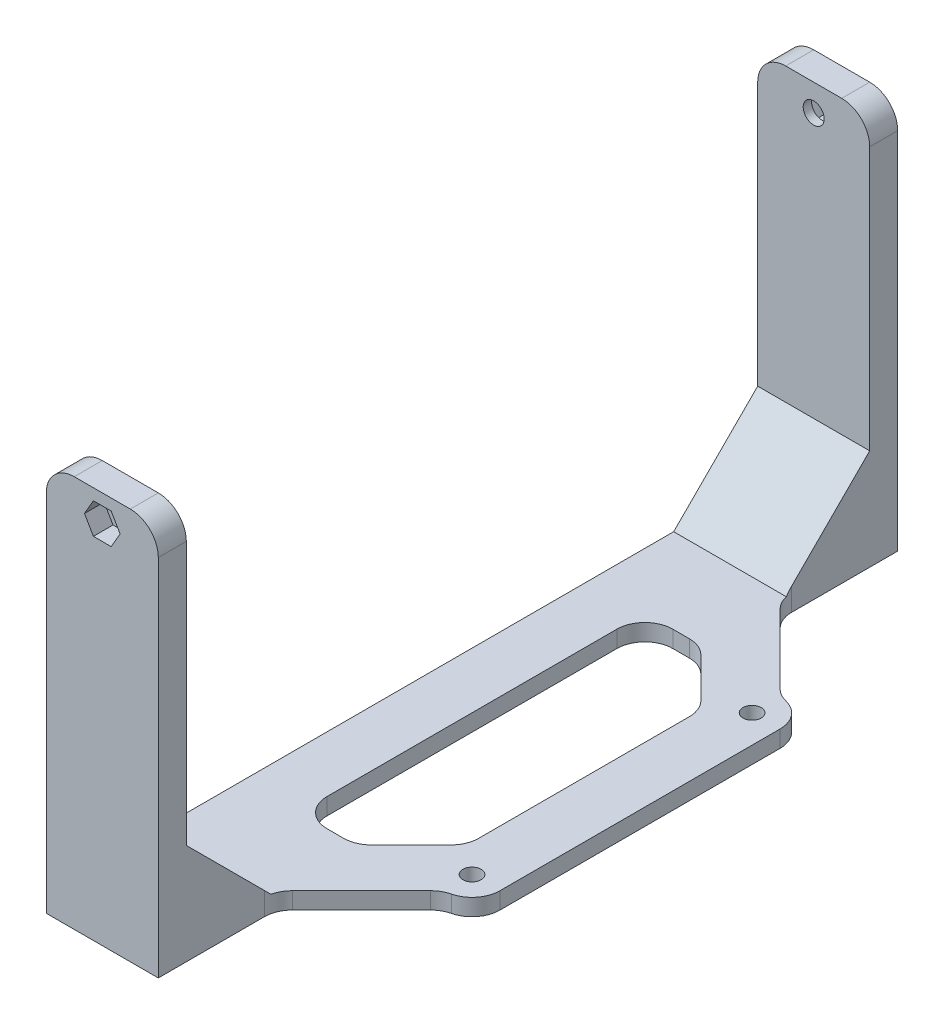
from build123d import *

# Parameters (mm, degrees)
SKETCH1_W           = 20
SKETCH1_H           = 132
BOSS_EXTRUDE1_DEPTH = 3
SKETCH2_W           = 20
SKETCH2_H           = 4.999999999999993
BOSS_EXTRUDE2_DEPTH = 67
SKETCH4_R           = 1.875000000000003
CUT_EXTRUDE1_DEPTH  = 150.74645237867907
FILLET3_R           = 5
CUT_EXTRUDE2_DEPTH  = 3.5
CUT_EXTRUDE3_DEPTH  = 3.5
SKETCH9_R           = 1.625000000000004
BOSS_EXTRUDE3_DEPTH = 3
CHAMFER1_SIZE       = 15
FILLET4_R           = 5
CUT_EXTRUDE4_DEPTH  = 99.71676655968832
FILLET5_R           = 5


with BuildPart() as part:
    # Sketch1 → Boss-Extrude1 (new body)
    with BuildSketch(Plane(origin=(0, 0, 0), x_dir=(1, 0, 0), z_dir=(0, 1, 0))):
        Rectangle(SKETCH1_W, SKETCH1_H)
    extrude(amount=BOSS_EXTRUDE1_DEPTH)

    # Sketch2 → Boss-Extrude2 (add)
    with BuildSketch(Plane(origin=(0, 3, 0), x_dir=(1, 0, 0), z_dir=(0, 1, 0))):
        Polygon((-10, -66), (10, -66), (9.999999999999998, -61.00000000000001), (-10, -61.00000000000001), align=None)
        with Locations((0, 63.5)):
            Rectangle(SKETCH2_W, SKETCH2_H)
    extrude(amount=BOSS_EXTRUDE2_DEPTH)

    # Sketch4 → Cut-Extrude1 (cut, through all)
    with BuildSketch(Plane.XY.offset(66)):
        with Locations((0, 65.2375)):
            Circle(SKETCH4_R)
    extrude(amount=-CUT_EXTRUDE1_DEPTH, mode=Mode.SUBTRACT)

    # Fillet3
    fillet3_edges = [part.edges().sort_by_distance(p)[0] for p in [
        (-10, 70, 63.5),
        (10, 70, 63.5),
        (-10, 70, -63.5),
        (10, 70, -63.5),
    ]]
    fillet(fillet3_edges, radius=FILLET3_R)

    # Sketch6 → Cut-Extrude2 (cut)
    with BuildSketch(Plane.XY.offset(66)):
        Polygon((3.175426480542929, 65.2375), (1.5877132402714664, 67.9875), (-1.5877132402714669, 67.9875), (-3.1754264805429386, 65.23749999999998), (-1.5877132402714738, 62.487500000000004), (1.587713240271455, 62.487500000000004), align=None)
    extrude(amount=-CUT_EXTRUDE2_DEPTH, mode=Mode.SUBTRACT)

    # Sketch7 → Cut-Extrude3 (cut)
    with BuildSketch(Plane(origin=(0, 0, -66), x_dir=(-1, 0, 0), z_dir=(0, 0, -1))):
        Polygon((3.2042939940024326, 65.2375), (1.6021469970012208, 68.0125), (-1.6021469970012086, 68.0125), (-3.204293994002428, 65.23749999999998), (-1.6021469970012214, 62.4625), (1.602146997001218, 62.4625), align=None)
    extrude(amount=-CUT_EXTRUDE3_DEPTH, mode=Mode.SUBTRACT)

    # Sketch9 → Boss-Extrude3 (add)
    with BuildSketch(Plane.XZ):
        Polygon((30.000000000000007, -29.999999999999996), (10, -30), (10, 30.000000000000004), (30.000000000000007, 30.000000000000004), align=None)
        with Locations(Location((25, -25, 0), (0, 0, 270))):
            Circle(SKETCH9_R, mode=Mode.SUBTRACT)
        with Locations(Location((25, 25, 0), (0, 0, 270))):
            Circle(SKETCH9_R, mode=Mode.SUBTRACT)
    extrude(amount=-BOSS_EXTRUDE3_DEPTH)

    # Chamfer1
    chamfer1_edges = [part.edges().sort_by_distance(p)[0] for p in [
        (10, 1.5, 30.000000000000004),
        (10, 1.5, -30),
        (-1.78e-15, 3, 61.00000000000001),
        (0, 3, -61.00000000000001),
    ]]
    chamfer(chamfer1_edges, length=CHAMFER1_SIZE)

    # Fillet4
    fillet4_edges = [part.edges().sort_by_distance(p)[0] for p in [
        (30.000000000000007, 1.5, 30.000000000000004),
        (30.000000000000007, 1.5, -29.999999999999996),
    ]]
    fillet(fillet4_edges, radius=FILLET4_R - 0.0001)  # a hair under: the kernel refuses the full size

    # Sketch10 → Cut-Extrude4 (cut, through all)
    with BuildSketch(Plane(origin=(0, 3, 0), x_dir=(1, 0, 0), z_dir=(0, 1, 0))):
        Polygon((-7.92e-15, 30.857864376268985), (1.097e-14, -30.857864376268985), (10.00000000000001, -30.857864376268985), (20.000000000000004, -20.85786437626899), (20.000000000000004, 20.857864376268978), (9.999999999999991, 30.857864376268992), align=None)
    extrude(amount=-CUT_EXTRUDE4_DEPTH, mode=Mode.SUBTRACT)

    # Fillet5
    fillet5_edges = [part.edges().sort_by_distance(p)[0] for p in [
        (25, 1.5, 30),
        (10, 1.5, 45),
        (10, 1.5, -45),
        (25, 1.5, -29.999999999999996),
        (10.00000000000001, 1.5, 30.857864376268985),
        (1.097e-14, 1.5, 30.857864376268985),
        (-7.92e-15, 1.5, -30.857864376268985),
        (9.999999999999991, 1.5, -30.857864376268992),
        (20.000000000000004, 1.5, -20.857864376268978),
        (20.000000000000004, 1.5, 20.85786437626899),
    ]]
    fillet(fillet5_edges, radius=FILLET5_R)


solid = part.part
